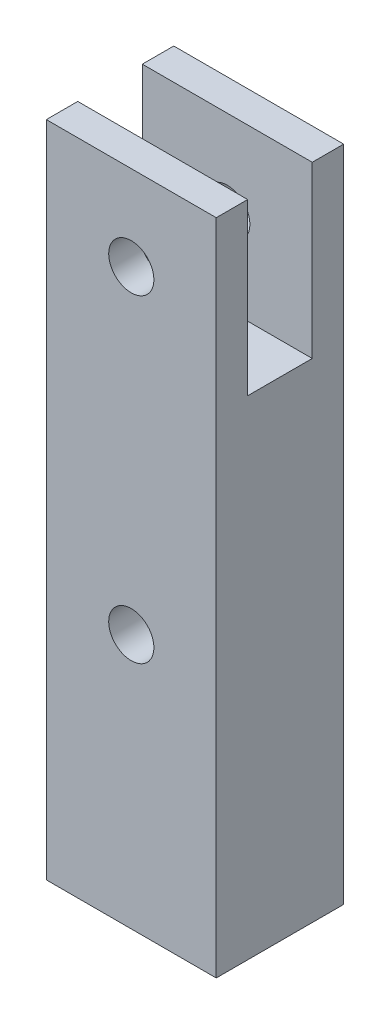
from build123d import *

# Parameters (mm, degrees)
SKETCH1_R           = 3.3782
BOSS_EXTRUDE1_DEPTH = 9.525
SKETCH3_W           = 9.652
SKETCH3_H           = 25.4
CUT_EXTRUDE1_DEPTH  = 68.594698618


with BuildPart() as part:
    # Sketch1 → Boss-Extrude1 (new, symmetric)
    with BuildSketch(Plane.XY):
        Polygon((-12.7, 23.8125), (-12.7, 36.5125), (12.7, 36.5125), (12.7, 23.8125), (12.7, -61.9125), (-12.7, -61.9125), align=None)
        with Locations((0, 23.8125)):
            Circle(SKETCH1_R, mode=Mode.SUBTRACT)
        with Locations((0, -23.8125)):
            Circle(SKETCH1_R, mode=Mode.SUBTRACT)
    extrude(amount=BOSS_EXTRUDE1_DEPTH, both=True)

    # Sketch3 → Cut-Extrude1 (cut, through all)
    with BuildSketch(Plane(origin=(12.7, 0, 0), x_dir=(0, 0, -1), z_dir=(1, 0, 0))):
        with Locations((0, 23.8125)):
            Rectangle(SKETCH3_W, SKETCH3_H)
    extrude(amount=-CUT_EXTRUDE1_DEPTH, mode=Mode.SUBTRACT)


solid = part.part
